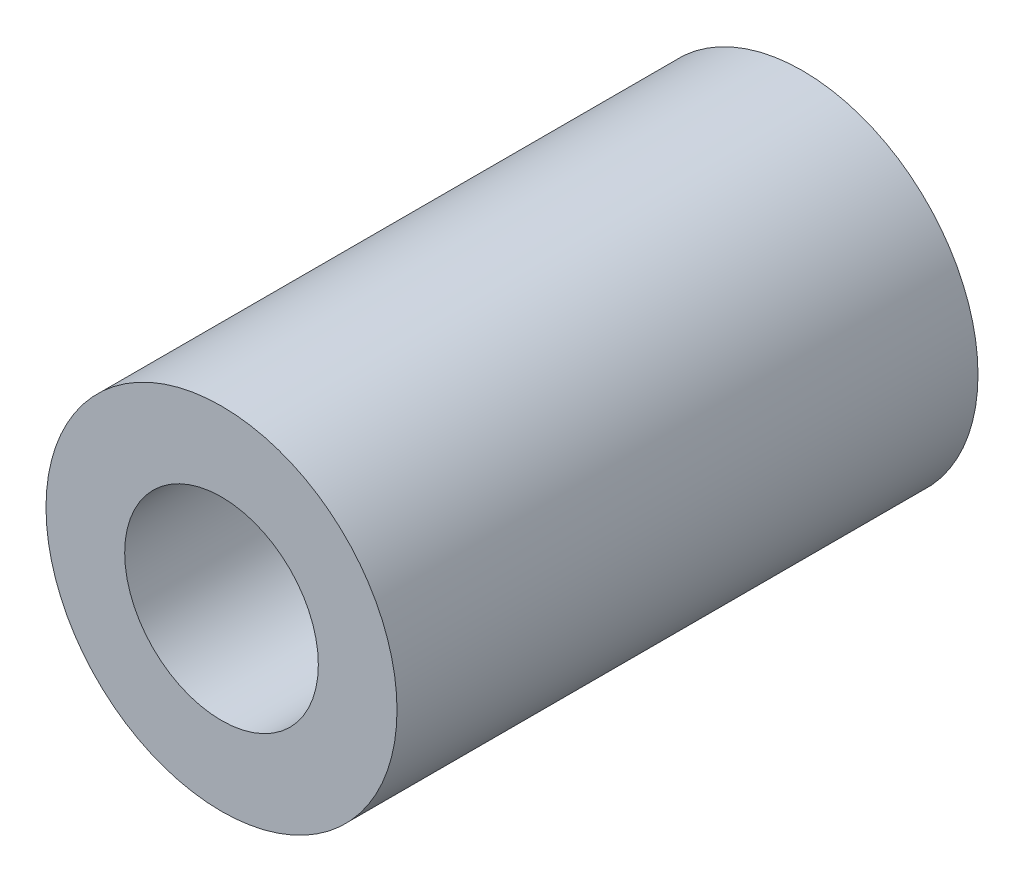
from build123d import *

# Parameters (mm, degrees)
SKETCH1_R               = 11.509375
BOSS_EXTRUDE1_DEPTH     = 38.1
CUT_EXTRUDE1_DEPTH      = 42.43116491
CUT_EXTRUDE1_DEPTH_BACK = 42.43116491
SKETCH2_R               = 6.35


with BuildPart() as part:
    # Sketch1 → Boss-Extrude1 (new body)
    with BuildSketch(Plane.XY):
        Circle(SKETCH1_R)
    extrude(amount=BOSS_EXTRUDE1_DEPTH)

    # Sketch2 → Cut-Extrude1 (cut, two sides: drawn at the far end of the back side and taken through both)
    with BuildSketch(Plane.XY.offset(38.1).offset(-CUT_EXTRUDE1_DEPTH_BACK)):
        Circle(SKETCH2_R)
    extrude(amount=CUT_EXTRUDE1_DEPTH + CUT_EXTRUDE1_DEPTH_BACK, mode=Mode.SUBTRACT)


solid = part.part
